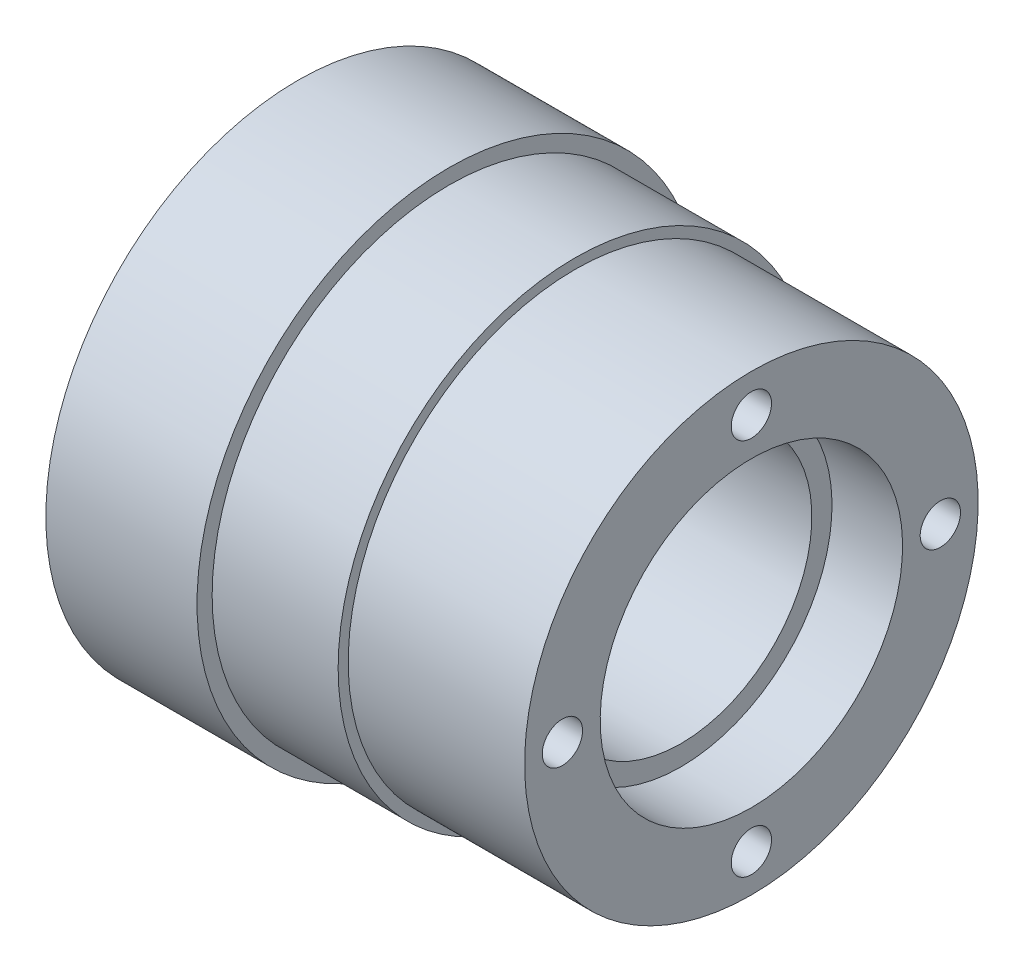
from build123d import *

# Parameters (mm, degrees)
SKETCH2_R          = 2
CUT_EXTRUDE1_DEPTH = 10
SKETCH3_R          = 2
CUT_EXTRUDE2_DEPTH = 10


with BuildPart() as part:
    # Sketch1 → Revolve1 (revolve)
    with BuildSketch(Plane.XY):
        Polygon((-22.5, 13.5), (-18.3, 13.5), (-18.3, 13), (15.5, 13), (15.5, 15), (22.5, 15), (22.5, 22.5), (5, 22.5), (5, 23.5), (-7.5, 23.5), (-7.5, 25), (-22.5, 25), align=None)
    revolve(axis=Axis((-22.5, 0, 0), (1, 0, 0)))

    # Sketch2 → Cut-Extrude1 (cut)
    with BuildSketch(Plane(origin=(22.5, 0, 0), x_dir=(0, 0, -1), z_dir=(1, 0, 0))):
        with Locations((0, 18.75)):
            Circle(SKETCH2_R)
        with Locations((18.75, 0)):
            Circle(SKETCH2_R)
        with Locations((0, -18.75)):
            Circle(SKETCH2_R)
        with Locations((-18.75, 0)):
            Circle(SKETCH2_R)
    extrude(amount=-CUT_EXTRUDE1_DEPTH, mode=Mode.SUBTRACT)

    # Sketch3 → Cut-Extrude2 (cut)
    with BuildSketch(Plane.ZY.offset(22.5)):
        with Locations((0, 19.25)):
            Circle(SKETCH3_R)
        with Locations((19.25, 0)):
            Circle(SKETCH3_R)
        with Locations((0, -19.25)):
            Circle(SKETCH3_R)
        with Locations((-19.25, 0)):
            Circle(SKETCH3_R)
    extrude(amount=-CUT_EXTRUDE2_DEPTH, mode=Mode.SUBTRACT)


solid = part.part
